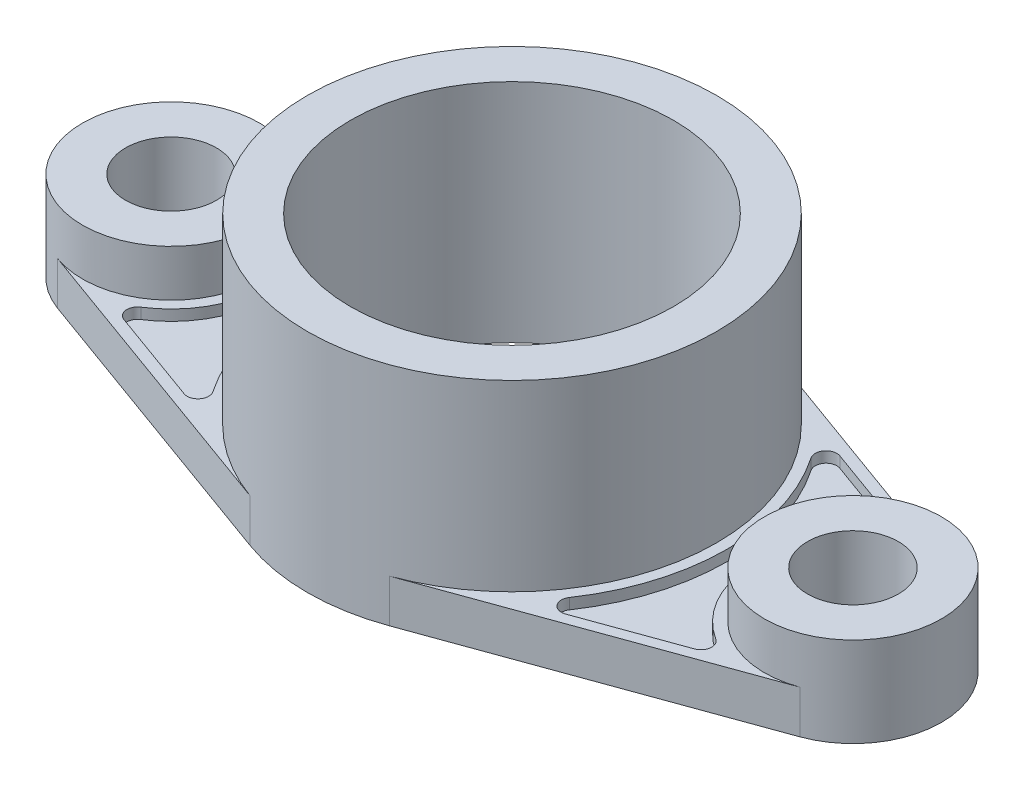
from build123d import *
from build123d.topology import SkipClean

# Parameters (mm, degrees)
SKETCH3_R                 = 12.666666667
SKETCH3_R_2               = 45
BOSS_EXTRUDE1_DEPTH       = 12
BOSS_EXTRUDE2_START       = 12
BOSS_EXTRUDE2_OUTLINE_R   = 24.666666667
BOSS_EXTRUDE2_OUTLINE_R_2 = 12.666666667
BOSS_EXTRUDE2_DEPTH       = 13
BOSS_EXTRUDE3_START       = 12
BOSS_EXTRUDE3_DEPTH       = 51
CUT_EXTRUDE1_DEPTH        = 3


# Read off the part's stored shape, not the designer's step: Boss-Extrude2
with BuildPart() as part:
    # Sketch3 → Boss-Extrude1 (new body)
    with BuildSketch(Plane(origin=(0, 0, 0), x_dir=(1, 0, 0), z_dir=(0, 1, 0))):
        with BuildLine():
            ThreePointArc((-103.395321637, 23.194029815), (-119.666666667, 0), (-103.395321637, -23.194029815))
            Line((-103.395321637, -23.194029815), (-19.4, -53.597014842))
            ThreePointArc((-19.4, -53.597014842), (0, -57), (19.4, -53.597014842))
            Line((19.4, -53.597014842), (103.395321637, -23.194029815))
            ThreePointArc((103.395321637, -23.194029815), (119.666666667, 0), (103.395321637, 23.194029815))
            Line((103.395321637, 23.194029815), (19.4, 53.597014842))
            ThreePointArc((19.4, 53.597014842), (0, 57), (-19.4, 53.597014842))
            Line((-19.4, 53.597014842), (-103.395321637, 23.194029815))
        make_face()
        with Locations(Location((-95, 0, 0), (0, 0, 270))):
            Circle(SKETCH3_R, mode=Mode.SUBTRACT)
        with Locations(Location((0, 0, 0), (0, 0, 270))):
            Circle(SKETCH3_R_2, mode=Mode.SUBTRACT)
        with Locations(Location((95, 0, 0), (0, 0, 270))):
            Circle(SKETCH3_R, mode=Mode.SUBTRACT)
    extrude(amount=BOSS_EXTRUDE1_DEPTH)

    # Boss-Extrude2 outline → Boss-Extrude2 (add)
    # profile 1 of 2: a face of its own
    with BuildSketch(Plane(origin=(0, 0, 0), x_dir=(1, 0, 0), z_dir=(0, 1, 0)).offset(BOSS_EXTRUDE2_START)):
        with Locations((-95, 0)):
            Circle(BOSS_EXTRUDE2_OUTLINE_R)
        with Locations((-95, 0)):
            Circle(BOSS_EXTRUDE2_OUTLINE_R_2, mode=Mode.SUBTRACT)
    # profile 2 of 2: a face of its own
    with BuildSketch(Plane(origin=(0, 0, 0), x_dir=(1, 0, 0), z_dir=(0, 1, 0)).offset(BOSS_EXTRUDE2_START)):
        with Locations((95, 0)):
            Circle(BOSS_EXTRUDE2_OUTLINE_R)
        with Locations((95, 0)):
            Circle(BOSS_EXTRUDE2_OUTLINE_R_2, mode=Mode.SUBTRACT)
    extrude(amount=BOSS_EXTRUDE2_DEPTH)

    # Sketch3<7> → Boss-Extrude3 (add)
    with SkipClean():  # the faces are left unmerged after this step: merging them gives an invalid solid
        with BuildSketch(Plane(origin=(0, 0, 0), x_dir=(1, 0, 0), z_dir=(0, 1, 0)).offset(BOSS_EXTRUDE3_START)):
            with BuildLine():
                ThreePointArc((-19.4, 53.597014842), (-46.662618872, 32.735302045), (-57, 0))
                Line((-57, 0), (-45, 0))
                ThreePointArc((-45, 0), (0, 45), (45, 0))
                Line((45, 0), (57, 0))
                ThreePointArc((57, 0), (46.662618872, 32.735302045), (19.4, 53.597014842))
                ThreePointArc((19.4, 53.597014842), (0, 57), (-19.4, 53.597014842))
            make_face()
            with BuildLine():
                Line((-45, 0), (-57, 0))
                ThreePointArc((-57, 0), (-46.662618872, -32.735302045), (-19.4, -53.597014842))
                ThreePointArc((-19.4, -53.597014842), (0, -57), (19.4, -53.597014842))
                ThreePointArc((19.4, -53.597014842), (46.662618872, -32.735302045), (57, 0))
                Line((57, 0), (45, 0))
                ThreePointArc((45, 0), (0, -45), (-45, 0))
            make_face()
        extrude(amount=BOSS_EXTRUDE3_DEPTH)

    # Sketch7 → Cut-Extrude1 (cut)
    with SkipClean():  # the faces are left unmerged after this step: merging them gives an invalid solid
        with BuildSketch(Plane(origin=(0, 12, 0), x_dir=(1, 0, 0), z_dir=(0, 1, 0))):
            with BuildLine():
                Line((79.495818927, -28.654228549), (53.157283033, -38.187737044))
                ThreePointArc((53.157283033, -38.187737044), (49.768127235, -37.208603561), (49.653552763, -33.682706216))
                ThreePointArc((49.653552763, -33.682706216), (60, 0), (49.653552763, 33.682706216))
                ThreePointArc((49.653552763, 33.682706216), (49.768127235, 37.208603561), (53.157283033, 38.187737044))
                Line((53.157283033, 38.187737044), (79.495818927, 28.654228549))
                ThreePointArc((79.495818927, 28.654228549), (81.456336863, 26.165352539), (80.091365245, 23.306159147))
                ThreePointArc((80.091365245, 23.306159147), (67.333333333, 0), (80.091365245, -23.306159147))
                ThreePointArc((80.091365245, -23.306159147), (81.456336863, -26.165352539), (79.495818927, -28.654228549))
            make_face()
            with BuildLine():
                Line((-53.157283033, 38.187737044), (-79.495818927, 28.654228549))
                ThreePointArc((-79.495818927, 28.654228549), (-81.456336863, 26.165352539), (-80.091365245, 23.306159147))
                ThreePointArc((-80.091365245, 23.306159147), (-67.333333333, 0), (-80.091365245, -23.306159147))
                ThreePointArc((-80.091365245, -23.306159147), (-81.456336863, -26.165352539), (-79.495818927, -28.654228549))
                Line((-79.495818927, -28.654228549), (-53.157283033, -38.187737044))
                ThreePointArc((-53.157283033, -38.187737044), (-49.768127235, -37.208603561), (-49.653552763, -33.682706216))
                ThreePointArc((-49.653552763, -33.682706216), (-60, 0), (-49.653552763, 33.682706216))
                ThreePointArc((-49.653552763, 33.682706216), (-49.768127235, 37.208603561), (-53.157283033, 38.187737044))
            make_face()
        extrude(amount=-CUT_EXTRUDE1_DEPTH, mode=Mode.SUBTRACT)


solid = part.part
